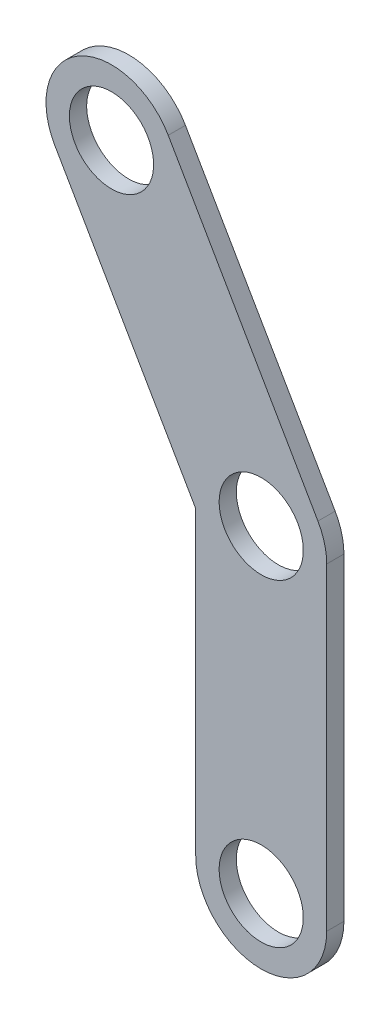
from build123d import *

# Parameters (mm, degrees)
SKETCH1_R           = 14.2875
BOSS_EXTRUDE1_DEPTH = 5.842


with BuildPart() as part:
    # Sketch1 → Boss-Extrude1 (new body)
    with BuildSketch(Plane(origin=(0, 0, 0), x_dir=(-1, 0, 0), z_dir=(0, 0, -1))):
        with BuildLine():
            Line((29.338575358, 103.663404121), (29.338575358, -4.286595879))
            ThreePointArc((29.338575358, -4.286595879), (51.563575358, -26.511595879), (73.788575358, -4.286595879))
            Line((73.788575358, -4.286595879), (73.788575358, 97.708233319))
            Line((73.788575358, 97.708233319), (121.610989957, 180.539085146))
            ThreePointArc((121.610989957, 180.539085146), (113.476075358, 210.898999745), (83.116160759, 202.764085146))
            Line((83.116160759, 202.764085146), (32.316160759, 114.775904121))
            ThreePointArc((32.316160759, 114.775904121), (30.095873869, 109.415657399), (29.338575358, 103.663404121))
        make_face()
        with Locations((51.563575358, 103.663404121)):
            Circle(SKETCH1_R, mode=Mode.SUBTRACT)
        with Locations((51.563575358, -4.286595879)):
            Circle(SKETCH1_R, mode=Mode.SUBTRACT)
        with Locations((102.363575358, 191.651585146)):
            Circle(SKETCH1_R, mode=Mode.SUBTRACT)
    extrude(amount=-BOSS_EXTRUDE1_DEPTH)


solid = part.part
